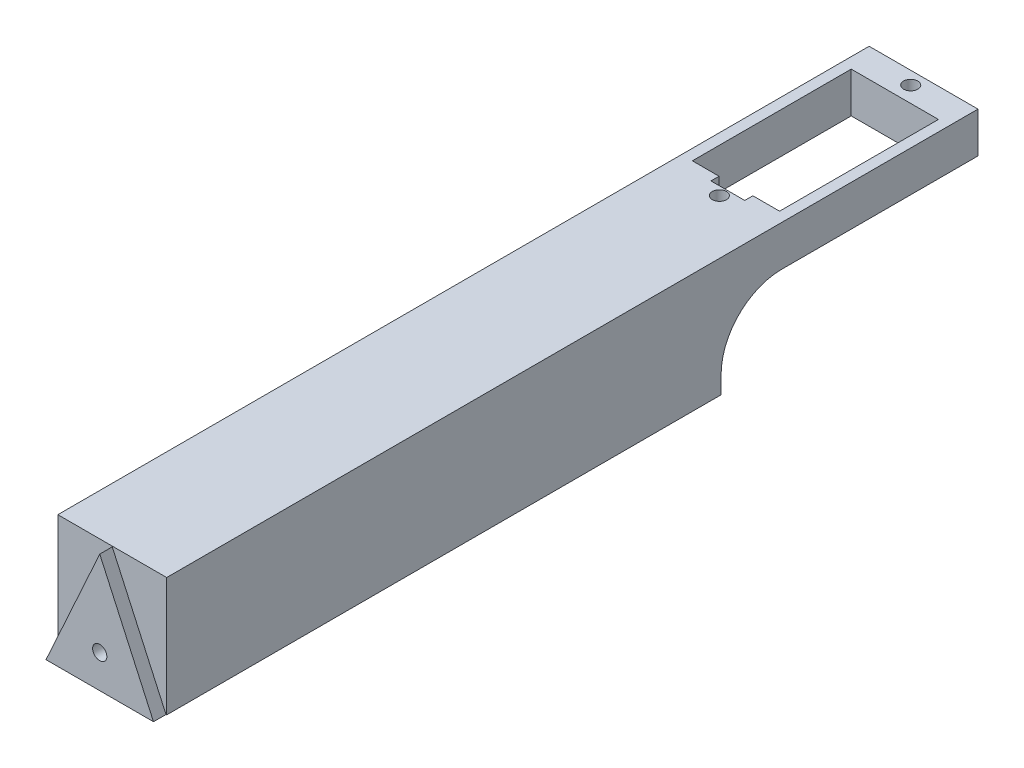
from build123d import *

# Parameters (mm, degrees)
SKIZZE1_W                       = 16.1
SKIZZE1_H                       = 120
AUFSATZ_LINEAR_AUSTRAGEN1_DEPTH = 17.6
AUFSATZ_LINEAR_AUSTRAGEN2_DEPTH = 1.85
SKIZZE3_R                       = 1.05
SCHNITT_LINEAR_AUSTRAGEN1_DEPTH = 13
SKIZZE4_R                       = 1.05
SCHNITT_LINEAR_AUSTRAGEN2_DEPTH = 65.807291256
SCHNITT_LINEAR_AUSTRAGEN3_DEPTH = 67.29021421


with BuildPart() as part:
    # Skizze1 → Aufsatz-Linear austragen1 (new body)
    with BuildSketch(Plane(origin=(0, 0, 0), x_dir=(1, 0, 0), z_dir=(0, 1, 0))):
        Rectangle(SKIZZE1_W, SKIZZE1_H)
    extrude(amount=AUFSATZ_LINEAR_AUSTRAGEN1_DEPTH)

    # Skizze2 → Aufsatz-Linear austragen2 (add)
    with BuildSketch(Plane.XY.offset(60)):
        Polygon((0, 17.5), (-7.95, 0), (7.95, 0), align=None)
    extrude(amount=AUFSATZ_LINEAR_AUSTRAGEN2_DEPTH)

    # Skizze3 → Schnitt-Linear austragen1 (cut)
    with BuildSketch(Plane.XY.offset(61.85)):
        with Locations((0, 4.89)):
            Circle(SKIZZE3_R)
    extrude(amount=-SCHNITT_LINEAR_AUSTRAGEN1_DEPTH, mode=Mode.SUBTRACT)

    # Skizze4 → Schnitt-Linear austragen2 (cut, through all)
    with BuildSketch(Plane(origin=(0, 17.6, 0), x_dir=(1, 0, 0), z_dir=(0, 1, 0))):
        with Locations((0, 58.1)):
            Circle(SKIZZE4_R)
        with Locations((0, 29.8)):
            Circle(SKIZZE4_R)
        Polygon((-6.45, 32.25), (-2.5, 32.25), (-2.5, 31.05), (2.5, 31.05), (2.5, 32.25), (6.45, 32.25), (6.45, 55.75), (-6.45, 55.75), align=None)
    extrude(amount=-SCHNITT_LINEAR_AUSTRAGEN2_DEPTH, mode=Mode.SUBTRACT)

    # Skizze5 → Schnitt-Linear austragen3 (cut, through all)
    with BuildSketch(Plane(origin=(8.05, 0, 0), x_dir=(0, 0, -1), z_dir=(1, 0, 0))):
        with BuildLine():
            Line((60, 11.6), (31, 11.6))
            ThreePointArc((31, 11.6), (24.636038969, 8.963961031), (22, 2.6))
            Line((22, 2.6), (22, 0))
            Line((22, 0), (60, 0))
            Line((60, 0), (60, 11.6))
        make_face()
    extrude(amount=-SCHNITT_LINEAR_AUSTRAGEN3_DEPTH, mode=Mode.SUBTRACT)


solid = part.part
